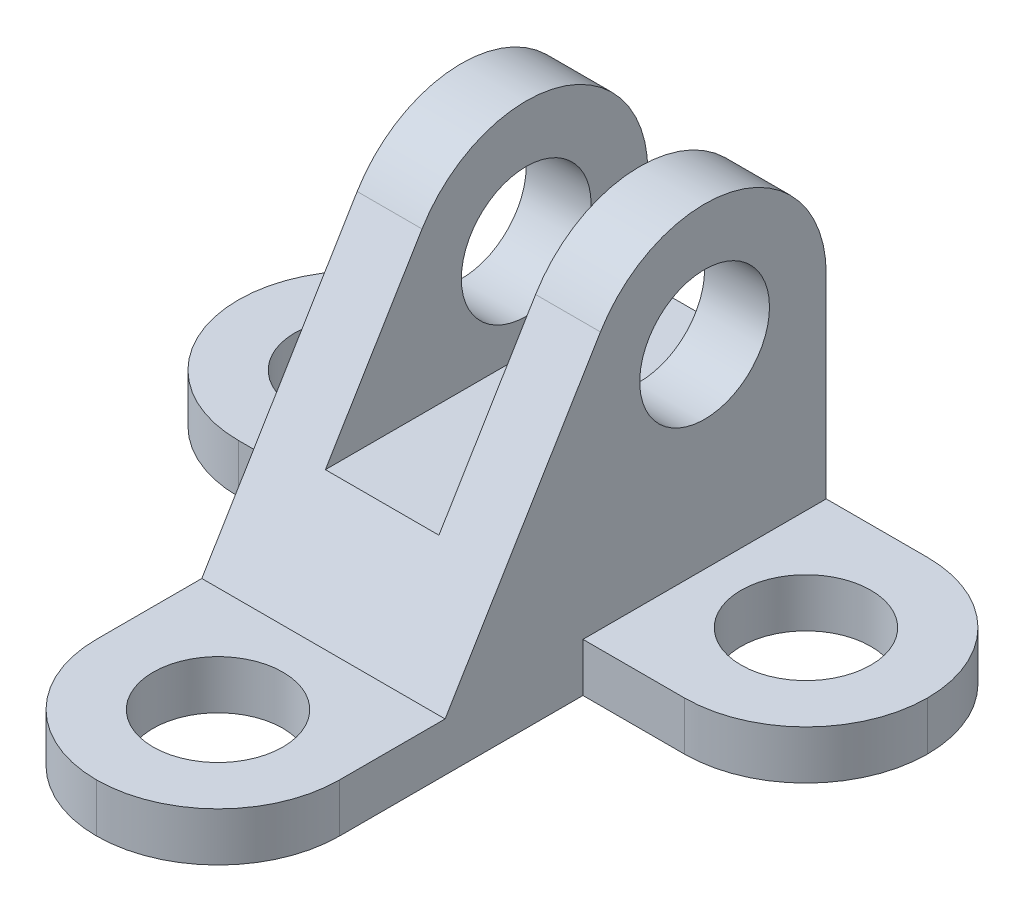
from build123d import *

# Parameters (mm, degrees)
BOSS_EXTRUDE1_DEPTH                 = 6
FILLET1_R                           = 15
BOSS_EXTRUDE2_DEPTH                 = 30
F_16_0_16_DIAMETER_HOLE1_D          = 16
SKETCH4_W                           = 14
SKETCH4_H                           = 27
CUT_EXTRUDE1_DEPTH                  = 50
SKETCH5_W                           = 8
SKETCH5_H                           = 6.001
F_16_0_16_DIAMETER_HOLE2_AT_2_COUNT = 2
F_16_0_16_DIAMETER_HOLE2_AT_2_PITCH = 52.737557774
F_16_0_16_DIAMETER_HOLE2_AT_3_COUNT = 2
F_16_0_16_DIAMETER_HOLE2_AT_3_PITCH = 52.737557774


with BuildPart() as part:
    # Sketch1 → Boss-Extrude1 (new body)
    with BuildSketch(Plane(origin=(0, 0, 0), x_dir=(1, 0, 0), z_dir=(0, 1, 0))):
        Polygon((57.5, 0), (57.5, -45), (27.5, -45), (27.5, 0), (0, 0), (0, 30), (85, 30), (85, 0), align=None)
    extrude(amount=BOSS_EXTRUDE1_DEPTH)

    # Fillet1
    fillet1_edges = [part.edges().sort_by_distance(p)[0] for p in [
        (85, 3, -30),
        (85, 3, 0),
        (0, 3, -30),
        (0, 3, 0),
        (27.5, 3, 45),
        (57.5, 3, 45),
    ]]
    fillet(fillet1_edges, radius=FILLET1_R - 0.0001)  # a hair under: the kernel refuses the full size

    # Sketch2 → Boss-Extrude2 (add)
    with BuildSketch(Plane(origin=(57.5, 0, 0), x_dir=(0, 0, -1), z_dir=(1, 0, 0))):
        with BuildLine():
            Line((-17, 6), (30, 6))
            Line((30, 6), (30, 30))
            ThreePointArc((30, 30), (19.021918108, 44.450749971), (2.156776702, 37.749297731))
            Line((2.156776702, 37.749297731), (-17, 6))
        make_face()
    extrude(amount=-BOSS_EXTRUDE2_DEPTH)

    # Ø16.0 (16) Diameter Hole1 (through all)
    with Locations(Plane(origin=(57.5, 30, -15), x_dir=(0, 0, 1), z_dir=(1, 0, 0))):
        with Locations((0, 0)):
            Hole(F_16_0_16_DIAMETER_HOLE1_D / 2)

    # Sketch4 → Cut-Extrude1 (cut)
    with BuildSketch(Plane(origin=(0, 0, -30), x_dir=(-1, 0, 0), z_dir=(0, 0, -1))):
        with Locations((-42.5, 31.5)):
            Rectangle(SKETCH4_W, SKETCH4_H)
    extrude(amount=-CUT_EXTRUDE1_DEPTH, mode=Mode.SUBTRACT)

    # Sketch5 → Ø16.0 (16) Diameter Hole2 (revolve, cut)
    with BuildSketch(Plane(origin=(42.5, 0, 30), x_dir=(0, 0, -1), z_dir=(1, 0, 0))):
        with Locations((4, 3.0005)):
            Rectangle(SKETCH5_W, SKETCH5_H)
    f_16_0_16_diameter_hole2 = revolve(axis=Axis((42.5, -6.35, 30), (0, 1, 0)), mode=Mode.SUBTRACT)

    # Ø16.0 (16) Diameter Hole2 at 2: Ø16.0 (16) Diameter Hole2 ×2
    with Locations(*[Vector(-0.521450009453975, 0, -0.853281833651959) * (i * F_16_0_16_DIAMETER_HOLE2_AT_2_PITCH) for i in range(1, F_16_0_16_DIAMETER_HOLE2_AT_2_COUNT)]):
        add(f_16_0_16_diameter_hole2, mode=Mode.SUBTRACT)

    # Ø16.0 (16) Diameter Hole2 at 3: Ø16.0 (16) Diameter Hole2 ×2
    with Locations(*[Vector(0.5214500094539749, 0, -0.8532818336519591) * (i * F_16_0_16_DIAMETER_HOLE2_AT_3_PITCH) for i in range(1, F_16_0_16_DIAMETER_HOLE2_AT_3_COUNT)]):
        add(f_16_0_16_diameter_hole2, mode=Mode.SUBTRACT)


solid = part.part
